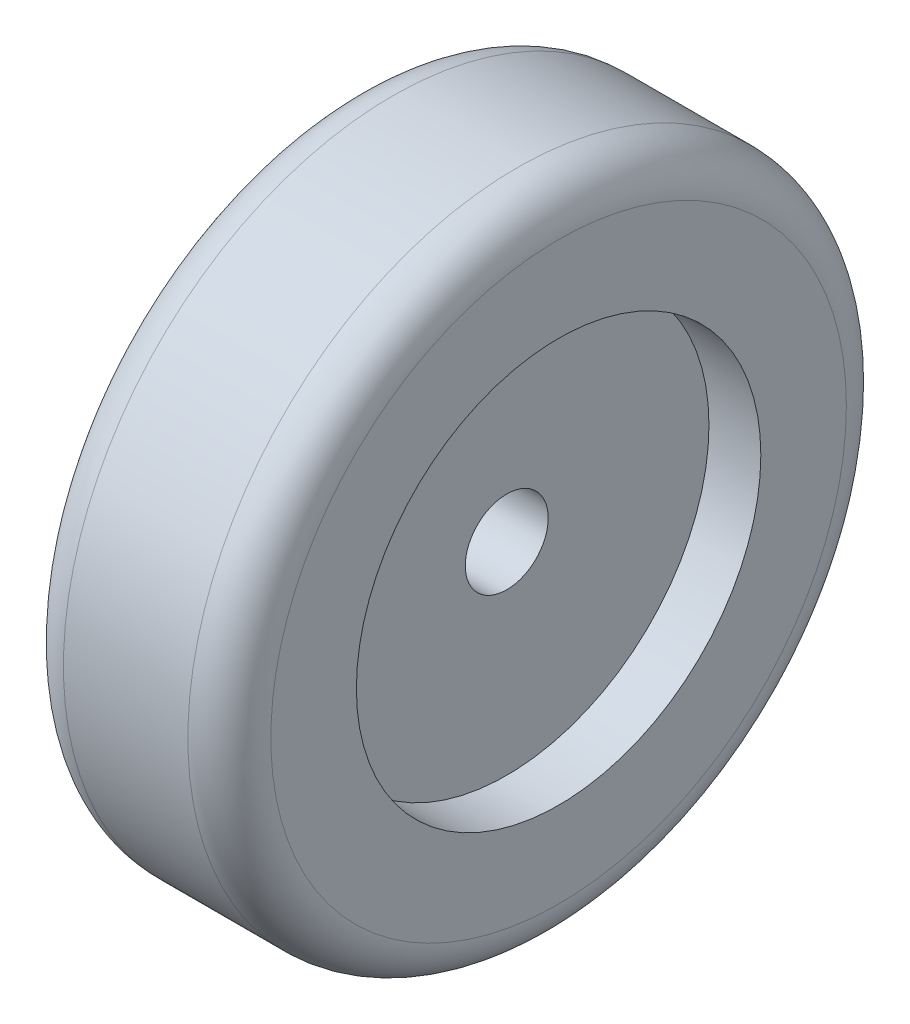
from build123d import *


with BuildPart() as part:
    # Croquis1 → Revolución1 (revolve)
    with BuildSketch(Plane.XY):
        with BuildLine():
            Line((9, 4), (9, 19.5))
            Line((9, 19.5), (14, 19.5))
            Line((14, 19.5), (14, 27.75))
            ThreePointArc((14, 27.75), (12.828427125, 30.578427125), (10, 31.75))
            Line((10, 31.75), (-2, 31.75))
            ThreePointArc((-2, 31.75), (-4.828427125, 30.578427125), (-6, 27.75))
            Line((-6, 27.75), (-6, 19.5))
            Line((-6, 19.5), (-9, 10))
            Line((-9, 10), (-9, 4))
            Line((-9, 4), (9, 4))
        make_face()
    revolve(axis=Axis((0, 0, 0), (-1, 0, 0)))


solid = part.part
